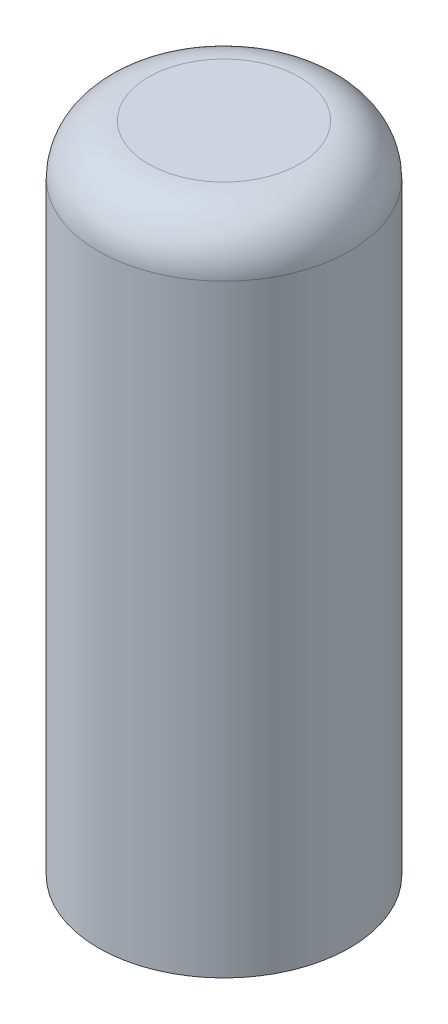
from build123d import *

# Parameters (mm, degrees)
SKETCH2_R           = 2.5
SKETCH2_W           = 1.95
SKETCH2_H           = 1.2
BOSS_EXTRUDE1_DEPTH = 6.5
FILLET1_R           = 1
SKETCH3_W           = 1.95
SKETCH3_H           = 1.2
BOSS_EXTRUDE5_DEPTH = 1


with BuildPart() as part:
    # Sketch2 → Boss-Extrude1 (new, symmetric)
    with BuildSketch(Plane(origin=(0, 0, 0), x_dir=(1, 0, 0), z_dir=(0, 1, 0))):
        Circle(SKETCH2_R)
        Rectangle(SKETCH2_W, SKETCH2_H, mode=Mode.SUBTRACT)
    extrude(amount=BOSS_EXTRUDE1_DEPTH, both=True)

    # Fillet1
    fillet1_edges = [part.edges().sort_by_distance(p)[0] for p in [
        (-2.5, 6.5, 0),
    ]]
    fillet(fillet1_edges, radius=FILLET1_R)

    # Sketch3 → Boss-Extrude5 (add)
    with BuildSketch(Plane(origin=(0, 6.5, 0), x_dir=(1, 0, 0), z_dir=(0, 1, 0))):
        Rectangle(SKETCH3_W, SKETCH3_H)
    extrude(amount=-BOSS_EXTRUDE5_DEPTH)


solid = part.part
